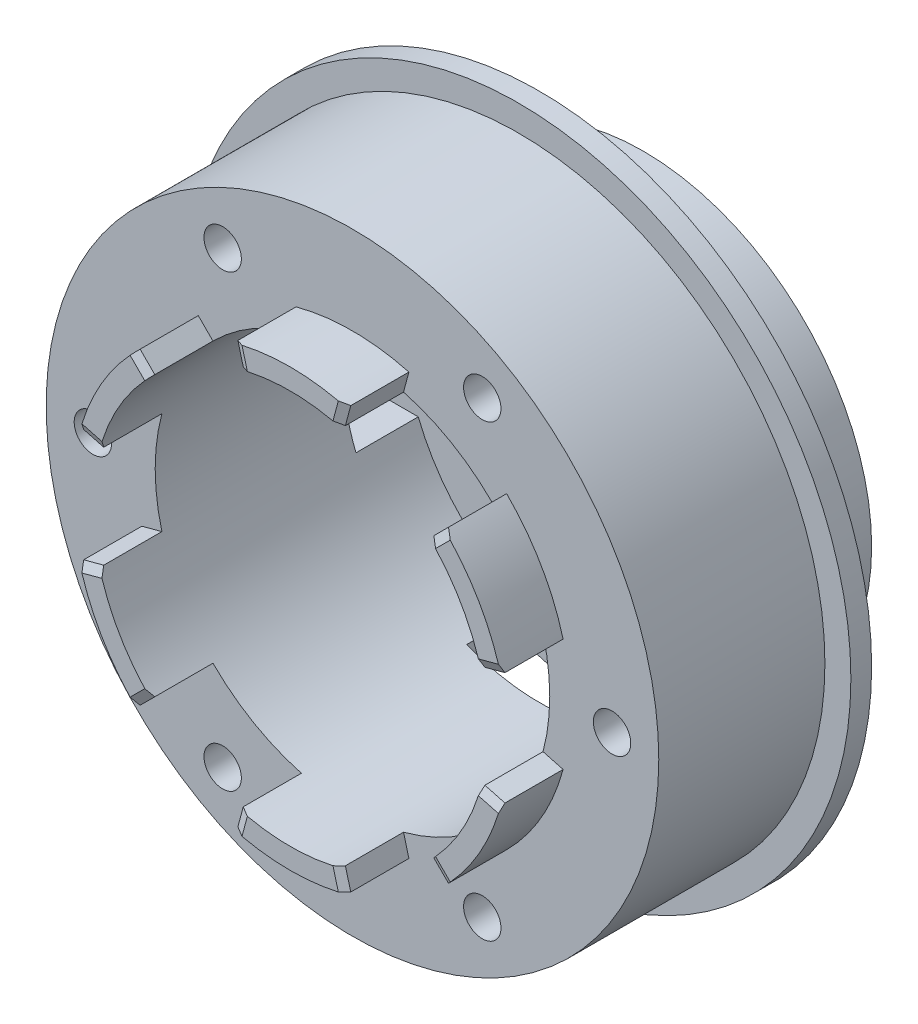
from build123d import *
from OCP.BRepFilletAPI import BRepFilletAPI_MakeChamfer

# Parameters (mm, degrees)
SKETCH_1_R               = 11
EXTRUDE_1_DEPTH          = 2
SKETCH_2_R               = 11
SKETCH_2_R_2             = 9.5
EXTRUDE_2_DEPTH          = 3
SKETCH_4_R               = 16
SKETCH_4_R_2             = 9.5
EXTRUDE_3_DEPTH          = 1
SKETCH_5_R               = 14.75
SKETCH_5_R_2             = 9.5
EXTRUDE_4_DEPTH          = 8
SKETCH_6_R               = 0.9
CUT_EXTRUDE_1_DEPTH      = 8
SKETCH_7_R               = 3
SKETCH_7_R_2             = 1.6
CUT_EXTRUDE_2_DEPTH      = 27.608269391
CUT_EXTRUDE_3_DEPTH      = 27.608269391
CUT_EXTRUDE_3_DEPTH_BACK = 27.608269391
SKETCH_8_W               = 7
SKETCH_8_H               = 3
CUT_EXTRUDE_4_DEPTH      = 27.608269391
CUT_EXTRUDE_4_DEPTH_BACK = 27.608269391
SKETCH_9_W               = 3
SKETCH_9_H               = 7
EXTRUDE_5_DEPTH          = 3
CHAMFER_1_SIZE           = 0.2
CHAMFER_1_SIZE2          = 0.410060768


with BuildPart() as part:
    # 스케치1 → 보스-돌출1 (new body)
    with BuildSketch(Plane.XY):
        Circle(SKETCH_1_R)
    extrude(amount=EXTRUDE_1_DEPTH)

    # 스케치2 → 보스-돌출2 (add)
    with BuildSketch(Plane.XY.offset(2)):
        Circle(SKETCH_2_R)
        Circle(SKETCH_2_R_2, mode=Mode.SUBTRACT)
    extrude(amount=EXTRUDE_2_DEPTH)

    # 스케치4 → 보스-돌출3 (add)
    with BuildSketch(Plane.XY.offset(5)):
        Circle(SKETCH_4_R)
        Circle(SKETCH_4_R_2, mode=Mode.SUBTRACT)
    extrude(amount=EXTRUDE_3_DEPTH)

    # 스케치5 → 보스-돌출4 (add)
    with BuildSketch(Plane.XY.offset(6)):
        Circle(SKETCH_5_R)
        Circle(SKETCH_5_R_2, mode=Mode.SUBTRACT)
    extrude(amount=EXTRUDE_4_DEPTH)

    # 스케치6 → 컷-돌출1 (cut)
    with BuildSketch(Plane.XY.offset(14)):
        with Locations((12.5, 0)):
            Circle(SKETCH_6_R)
        with Locations((6.25, -10.825317547)):
            Circle(SKETCH_6_R)
        with Locations((-6.25, -10.825317547)):
            Circle(SKETCH_6_R)
        with Locations((-12.5, 0)):
            Circle(SKETCH_6_R)
        with Locations((-6.25, 10.825317547)):
            Circle(SKETCH_6_R)
        with Locations((6.25, 10.825317547)):
            Circle(SKETCH_6_R)
    extrude(amount=-CUT_EXTRUDE_1_DEPTH, mode=Mode.SUBTRACT)

    # 스케치7 → 컷-돌출2 (cut, through all)
    with BuildSketch(Plane(origin=(0, 0, 0), x_dir=(-1, 0, 0), z_dir=(0, 0, -1))):
        Circle(SKETCH_7_R)
        with Locations((-7, 0)):
            Circle(SKETCH_7_R_2)
        with Locations((7, 0)):
            Circle(SKETCH_7_R_2)
        with Locations((0, 7)):
            Circle(SKETCH_7_R_2)
        with Locations((0, -7)):
            Circle(SKETCH_7_R_2)
    extrude(amount=-CUT_EXTRUDE_2_DEPTH, mode=Mode.SUBTRACT)

    # 스케치8 → 컷-돌출3 (cut, two sides: drawn at the far end of the back side and taken through both)
    with BuildSketch(Plane(origin=(0, 0, 0), x_dir=(1, 0, 0), z_dir=(0, 1, 0)).offset(-CUT_EXTRUDE_3_DEPTH_BACK)):
        with Locations((0, -3.5)):
            Rectangle(SKETCH_8_W, SKETCH_8_H)
    extrude(amount=CUT_EXTRUDE_3_DEPTH + CUT_EXTRUDE_3_DEPTH_BACK, mode=Mode.SUBTRACT)

    # 스케치9 → 컷-돌출4 (cut, two sides: drawn at the far end of the back side and taken through both)
    with BuildSketch(Plane(origin=(0, 0, 0), x_dir=(0, 0, -1), z_dir=(1, 0, 0)).offset(-CUT_EXTRUDE_4_DEPTH_BACK)):
        with Locations((-3.5, 0)):
            Rectangle(SKETCH_9_W, SKETCH_9_H)
    extrude(amount=CUT_EXTRUDE_4_DEPTH + CUT_EXTRUDE_4_DEPTH_BACK, mode=Mode.SUBTRACT)

    # 스케치10 → 보스-돌출5 (add)
    with BuildSketch(Plane.XY.offset(14)):
        with BuildLine():
            Line((2.458780928, 9.17629535), (2.717599974, 10.142221176))
            ThreePointArc((2.717599974, 10.142221176), (0, 10.5), (-2.717599974, 10.142221176))
            Line((-2.717599974, 10.142221176), (-2.458780928, 9.17629535))
            ThreePointArc((-2.458780928, 9.17629535), (0, 9.5), (2.458780928, 9.17629535))
        make_face()
        with BuildLine():
            Line((6.717514421, 6.717514421), (7.424621202, 7.424621202))
            ThreePointArc((7.424621202, 7.424621202), (9.09326674, 5.25), (10.142221176, 2.717599974))
            Line((10.142221176, 2.717599974), (9.17629535, 2.458780928))
            ThreePointArc((9.17629535, 2.458780928), (8.227241336, 4.75), (6.717514421, 6.717514421))
        make_face()
        with BuildLine():
            Line((9.17629535, -2.458780928), (10.142221176, -2.717599974))
            ThreePointArc((10.142221176, -2.717599974), (9.09326674, -5.25), (7.424621202, -7.424621202))
            Line((7.424621202, -7.424621202), (6.717514421, -6.717514421))
            ThreePointArc((6.717514421, -6.717514421), (8.227241336, -4.75), (9.17629535, -2.458780928))
        make_face()
        with BuildLine():
            Line((2.458780928, -9.17629535), (2.717599974, -10.142221176))
            ThreePointArc((2.717599974, -10.142221176), (0, -10.5), (-2.717599974, -10.142221176))
            Line((-2.717599974, -10.142221176), (-2.458780928, -9.17629535))
            ThreePointArc((-2.458780928, -9.17629535), (0, -9.5), (2.458780928, -9.17629535))
        make_face()
        with BuildLine():
            Line((-6.717514421, -6.717514421), (-7.424621202, -7.424621202))
            ThreePointArc((-7.424621202, -7.424621202), (-9.09326674, -5.25), (-10.142221176, -2.717599974))
            Line((-10.142221176, -2.717599974), (-9.17629535, -2.458780928))
            ThreePointArc((-9.17629535, -2.458780928), (-8.227241336, -4.75), (-6.717514421, -6.717514421))
        make_face()
        with BuildLine():
            Line((-9.17629535, 2.458780928), (-10.142221176, 2.717599974))
            ThreePointArc((-10.142221176, 2.717599974), (-9.09326674, 5.25), (-7.424621202, 7.424621202))
            Line((-7.424621202, 7.424621202), (-6.717514421, 6.717514421))
            ThreePointArc((-6.717514421, 6.717514421), (-8.227241336, 4.75), (-9.17629535, 2.458780928))
        make_face()
    extrude(amount=EXTRUDE_5_DEPTH)

    # 모따기1: one chamfer whose edges measure the first distance from different faces: ONE call of the kernel's chamfer builder (chamfer() names one face for all edges)
    chamfer_1_edges_1 = [part.edges().sort_by_distance(p)[0] for p in [
        (-9.659258263, -2.588190451, 17),
    ]]
    chamfer_1_side_1 = [part.faces().sort_by_distance(p)[0] for p in [
        (-9.659258263, -2.588190451, 15.5),
    ]]
    chamfer_1_edges_2 = [part.edges().sort_by_distance(p)[0] for p in [
        (-7.071067812, -7.071067812, 17),
    ]]
    chamfer_1_side_2 = [part.faces().sort_by_distance(p)[0] for p in [
        (-7.071067812, -7.071067812, 15.5),
    ]]
    chamfer_1_edges_3 = [part.edges().sort_by_distance(p)[0] for p in [
        (-2.588190451, -9.659258263, 17),
    ]]
    chamfer_1_side_3 = [part.faces().sort_by_distance(p)[0] for p in [
        (-2.588190451, -9.659258263, 15.5),
    ]]
    chamfer_1_edges_4 = [part.edges().sort_by_distance(p)[0] for p in [
        (2.588190451, -9.659258263, 17),
    ]]
    chamfer_1_side_4 = [part.faces().sort_by_distance(p)[0] for p in [
        (2.588190451, -9.659258263, 15.5),
    ]]
    chamfer_1_edges_5 = [part.edges().sort_by_distance(p)[0] for p in [
        (7.071067812, -7.071067812, 17),
    ]]
    chamfer_1_side_5 = [part.faces().sort_by_distance(p)[0] for p in [
        (7.071067812, -7.071067812, 15.5),
    ]]
    chamfer_1_edges_6 = [part.edges().sort_by_distance(p)[0] for p in [
        (9.659258263, -2.588190451, 17),
    ]]
    chamfer_1_side_6 = [part.faces().sort_by_distance(p)[0] for p in [
        (9.659258263, -2.588190451, 15.5),
    ]]
    chamfer_1_edges_7 = [part.edges().sort_by_distance(p)[0] for p in [
        (9.659258263, 2.588190451, 17),
    ]]
    chamfer_1_side_7 = [part.faces().sort_by_distance(p)[0] for p in [
        (9.659258263, 2.588190451, 15.5),
    ]]
    chamfer_1_edges_8 = [part.edges().sort_by_distance(p)[0] for p in [
        (7.071067812, 7.071067812, 17),
    ]]
    chamfer_1_side_8 = [part.faces().sort_by_distance(p)[0] for p in [
        (7.071067812, 7.071067812, 15.5),
    ]]
    chamfer_1_edges_9 = [part.edges().sort_by_distance(p)[0] for p in [
        (2.588190451, 9.659258263, 17),
    ]]
    chamfer_1_side_9 = [part.faces().sort_by_distance(p)[0] for p in [
        (2.588190451, 9.659258263, 15.5),
    ]]
    chamfer_1_edges_10 = [part.edges().sort_by_distance(p)[0] for p in [
        (-2.588190451, 9.659258263, 17),
    ]]
    chamfer_1_side_10 = [part.faces().sort_by_distance(p)[0] for p in [
        (-2.588190451, 9.659258263, 15.5),
    ]]
    chamfer_1_edges_11 = [part.edges().sort_by_distance(p)[0] for p in [
        (-7.071067812, 7.071067812, 17),
    ]]
    chamfer_1_side_11 = [part.faces().sort_by_distance(p)[0] for p in [
        (-7.071067812, 7.071067812, 15.5),
    ]]
    chamfer_1_edges_12 = [part.edges().sort_by_distance(p)[0] for p in [
        (-9.659258263, 2.588190451, 17),
    ]]
    chamfer_1_side_12 = [part.faces().sort_by_distance(p)[0] for p in [
        (-9.659258263, 2.588190451, 15.5),
    ]]
    chamfer_1 = BRepFilletAPI_MakeChamfer(part.part.solid().wrapped)
    for e in chamfer_1_edges_1:
        chamfer_1.Add(CHAMFER_1_SIZE, CHAMFER_1_SIZE2, e.wrapped, chamfer_1_side_1[0].wrapped)  # the first distance lies on this face
    for e in chamfer_1_edges_2:
        chamfer_1.Add(CHAMFER_1_SIZE, CHAMFER_1_SIZE2, e.wrapped, chamfer_1_side_2[0].wrapped)  # the first distance lies on this face
    for e in chamfer_1_edges_3:
        chamfer_1.Add(CHAMFER_1_SIZE, CHAMFER_1_SIZE2, e.wrapped, chamfer_1_side_3[0].wrapped)  # the first distance lies on this face
    for e in chamfer_1_edges_4:
        chamfer_1.Add(CHAMFER_1_SIZE, CHAMFER_1_SIZE2, e.wrapped, chamfer_1_side_4[0].wrapped)  # the first distance lies on this face
    for e in chamfer_1_edges_5:
        chamfer_1.Add(CHAMFER_1_SIZE, CHAMFER_1_SIZE2, e.wrapped, chamfer_1_side_5[0].wrapped)  # the first distance lies on this face
    for e in chamfer_1_edges_6:
        chamfer_1.Add(CHAMFER_1_SIZE, CHAMFER_1_SIZE2, e.wrapped, chamfer_1_side_6[0].wrapped)  # the first distance lies on this face
    for e in chamfer_1_edges_7:
        chamfer_1.Add(CHAMFER_1_SIZE, CHAMFER_1_SIZE2, e.wrapped, chamfer_1_side_7[0].wrapped)  # the first distance lies on this face
    for e in chamfer_1_edges_8:
        chamfer_1.Add(CHAMFER_1_SIZE, CHAMFER_1_SIZE2, e.wrapped, chamfer_1_side_8[0].wrapped)  # the first distance lies on this face
    for e in chamfer_1_edges_9:
        chamfer_1.Add(CHAMFER_1_SIZE, CHAMFER_1_SIZE2, e.wrapped, chamfer_1_side_9[0].wrapped)  # the first distance lies on this face
    for e in chamfer_1_edges_10:
        chamfer_1.Add(CHAMFER_1_SIZE, CHAMFER_1_SIZE2, e.wrapped, chamfer_1_side_10[0].wrapped)  # the first distance lies on this face
    for e in chamfer_1_edges_11:
        chamfer_1.Add(CHAMFER_1_SIZE, CHAMFER_1_SIZE2, e.wrapped, chamfer_1_side_11[0].wrapped)  # the first distance lies on this face
    for e in chamfer_1_edges_12:
        chamfer_1.Add(CHAMFER_1_SIZE, CHAMFER_1_SIZE2, e.wrapped, chamfer_1_side_12[0].wrapped)  # the first distance lies on this face
    add(Compound.cast(chamfer_1.Shape()), mode=Mode.REPLACE)


solid = part.part
